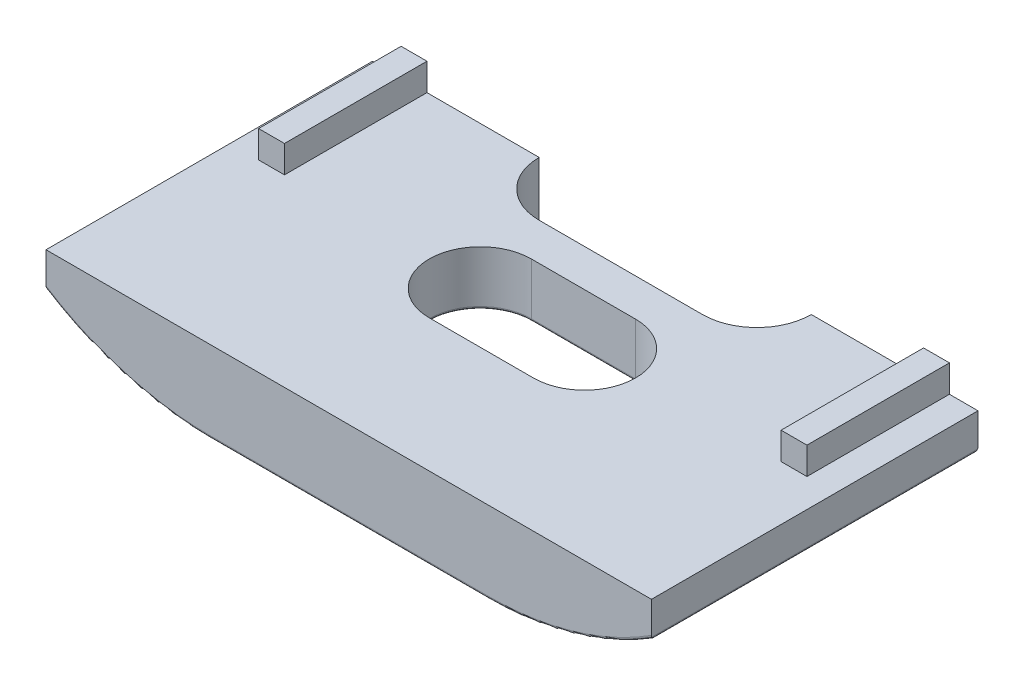
from build123d import *

# Parameters (mm, degrees)
EXTRUDE_1_DEPTH     = 24
SKETCH_2_W          = 20
SKETCH_2_H          = 4
CUT_EXTRUDE_1_DEPTH = 4
SKETCH_3_W          = 1.9
SKETCH_3_H          = 10.472908188
EXTRUDE_2_DEPTH     = 2
FILLET_1_R          = 4
CUT_EXTRUDE_2_DEPTH = 34.690688625
SWEEP_START         = -3.83
SWEEP_4_3_DEPTH     = 7.66
FILLET_2_R          = 0.2
FILLET_3_R          = 0.2


with BuildPart() as part:
    # Эскиз1 → Бобышка-Вытянуть1 (new body)
    with BuildSketch(Plane.XY):
        with BuildLine():
            Line((-20.25, 2.586649223), (20.25, 2.586649223))
            Line((20.25, 2.586649223), (22.25, 2.586649223))
            Line((22.25, 2.586649223), (22.25, 0.053782912))
            ThreePointArc((22.25, 0.053782912), (16.495418641, -2.529195567), (10.25, -3.413350777))
            Line((10.25, -3.413350777), (-10.25, -3.413350777))
            ThreePointArc((-10.25, -3.413350777), (-16.495418641, -2.529195567), (-22.25, 0.053782912))
            Line((-22.25, 0.053782912), (-22.25, 2.586649223))
            Line((-22.25, 2.586649223), (-20.25, 2.586649223))
        make_face()
    extrude(amount=EXTRUDE_1_DEPTH)

    # Эскиз2 → Вырез-Вытянуть1 (cut)
    with BuildSketch(Plane(origin=(0, 2.586649223, 0), x_dir=(1, 0, 0), z_dir=(0, 1, 0))):
        with Locations((0, -2)):
            Rectangle(SKETCH_2_W, SKETCH_2_H)
    extrude(amount=-CUT_EXTRUDE_1_DEPTH, mode=Mode.SUBTRACT)

    # Эскиз3 → Бобышка-Вытянуть2 (add)
    with BuildSketch(Plane(origin=(0, 2.586649223, 0), x_dir=(1, 0, 0), z_dir=(0, 1, 0))):
        with Locations((19.2, -5.236454094)):
            Rectangle(SKETCH_3_W, SKETCH_3_H)
        with Locations((-19.2, -5.236454094)):
            Rectangle(SKETCH_3_W, SKETCH_3_H)
    extrude(amount=EXTRUDE_2_DEPTH)

    # Скругление1
    fillet_1_edges = [part.edges().sort_by_distance(p)[0] for p in [
        (-10, 0.586649223, 4),
        (10, 0.586649223, 4),
    ]]
    fillet(fillet_1_edges, radius=FILLET_1_R - 0.0001)  # a hair under: the kernel refuses the full size

    # Эскиз4 → Вырез-Вытянуть2 (cut, through all)
    with BuildSketch(Plane.XZ.offset(3.413350777)):
        with BuildLine():
            Line((-3.83, 14.25), (3.83, 14.25))
            ThreePointArc((3.83, 14.25), (7.58, 10.5), (3.83, 6.75))
            Line((3.83, 6.75), (-3.83, 6.75))
            ThreePointArc((-3.83, 6.75), (-7.58, 10.5), (-3.83, 14.25))
        make_face()
    extrude(amount=-CUT_EXTRUDE_2_DEPTH, mode=Mode.SUBTRACT)

    # Вырез-По траектории4: read off the stored shape, not the designer's step
    # Вырез-По траектории4 outline → Вырез-По траектории4 (revolve, cut)
    with BuildSketch(Plane(origin=(3.83, 0, 10.5), x_dir=(1, 0, 0), z_dir=(0, 0, 1))):
        with BuildLine():
            Line((3.75, -3.413351016), (7.214101753, -3.413351016))
            ThreePointArc((7.214101753, -3.413351016), (5.750000119, -1.949249231), (3.75, -1.413350777))
            Line((3.75, -1.413350777), (3.75, -3.413351016))
        make_face()
    revolve(axis=Axis((3.83, 0, 10.5), (0, 1, 0)), mode=Mode.SUBTRACT)

    # Sweep 4 2 outline → Sweep 4 2 (revolve, cut)
    with BuildSketch(Plane(origin=(-3.83, 0, 10.5), x_dir=(1, 0, 0), z_dir=(0, 0, 1))):
        with BuildLine():
            Line((3.75, -3.413350777), (7.214101615, -3.413350777))
            ThreePointArc((7.214101615, -3.413350777), (5.75, -1.949249162), (3.75, -1.413350777))
            Line((3.75, -1.413350777), (3.75, -3.413350777))
        make_face()
    revolve(axis=Axis((-3.83, 0, 10.5), (0, 1, 0)), mode=Mode.SUBTRACT)

    # Sweep 4 3 outline → Sweep 4 3 (cut)
    with BuildSketch(Plane.YZ.offset(SWEEP_START)):
        with BuildLine():
            ThreePointArc((-1.413350777, 14.25), (-1.949249162, 16.25), (-3.413350777, 17.714101615))
            Line((-3.413350777, 17.714101615), (-3.413350777, 3.285898385))
            ThreePointArc((-3.413350777, 3.285898385), (-1.949249162, 4.75), (-1.413350777, 6.75))
            Line((-1.413350777, 6.75), (-1.413350777, 14.25))
        make_face()
    extrude(amount=SWEEP_4_3_DEPTH, mode=Mode.SUBTRACT)

    # Скругление2
    fillet_2_edges = [part.edges().sort_by_distance(p)[0] for p in [
        (0, -1.413350777, 14.25),
        (0, -1.413350777, 6.75),
        (-7.58, -1.413350777, 10.5),
        (-11.036133766, -3.39961311, 10.500000042),
        (-7.592036663, -3.413350777, 16.65551316),
        (-7.592036663, -3.413350777, 4.34448684),
        (0, -3.413350777, 3.285898385),
        (6.481650429, -1.413350777, 13.151650429),
        (7.59203662, -3.413351016, 16.655513348),
        (10.838298925, -3.40565846, 12.191976989),
        (7.59203662, -3.413351016, 4.344486652),
        (0, -3.413350777, 17.714101615),
    ]]
    fillet(fillet_2_edges, radius=FILLET_2_R)

    # Скругление3
    fillet_3_edges = [part.edges().sort_by_distance(p)[0] for p in [
        (-16.495418641, -2.529195567, 24),
        (0, -3.413350777, 24),
        (22.25, 0.053782912, 12),
        (-22.25, 0.053782912, 12),
        (16.495418641, -2.529195567, 24),
        (16.495418641, -2.529195567, 0),
        (0, -3.413350777, 0),
        (-16.495418641, -2.529195567, 0),
    ]]
    fillet(fillet_3_edges, radius=FILLET_3_R)


solid = part.part
